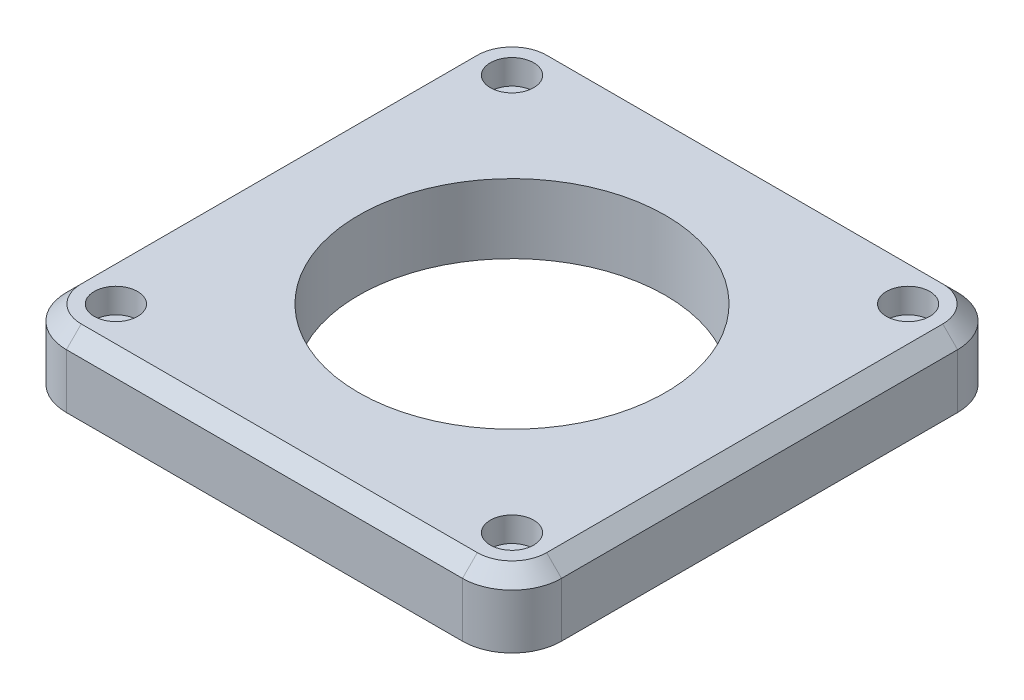
from build123d import *

# Parameters (mm, degrees)
SKETCH1_R           = 31
SKETCH1_R_2         = 2.625
BOSS_EXTRUDE1_DEPTH = 14
SKETCH2_R           = 4.375
CUT_EXTRUDE1_DEPTH  = 5
CHAMFER1_SIZE       = 3


with BuildPart() as part:
    # Sketch1 → Boss-Extrude1 (new body)
    with BuildSketch(Plane(origin=(0, 0, 0), x_dir=(1, 0, 0), z_dir=(0, 1, 0))):
        with BuildLine():
            Line((-40, -50), (40, -50))
            ThreePointArc((40, -50), (47.071067812, -47.071067812), (50, -40))
            Line((50, -40), (50, 40))
            ThreePointArc((50, 40), (47.071067812, 47.071067812), (40, 50))
            Line((40, 50), (-40, 50))
            ThreePointArc((-40, 50), (-47.071067812, 47.071067812), (-50, 40))
            Line((-50, 40), (-50, -40))
            ThreePointArc((-50, -40), (-47.071067812, -47.071067812), (-40, -50))
        make_face()
        Circle(SKETCH1_R, mode=Mode.SUBTRACT)
        with Locations((-40, -40)):
            Circle(SKETCH1_R_2, mode=Mode.SUBTRACT)
        with Locations((40, -40)):
            Circle(SKETCH1_R_2, mode=Mode.SUBTRACT)
        with Locations((40, 40)):
            Circle(SKETCH1_R_2, mode=Mode.SUBTRACT)
        with Locations((-40, 40)):
            Circle(SKETCH1_R_2, mode=Mode.SUBTRACT)
    extrude(amount=BOSS_EXTRUDE1_DEPTH)

    # Sketch2 → Cut-Extrude1 (cut)
    with BuildSketch(Plane(origin=(0, 14, 0), x_dir=(1, 0, 0), z_dir=(0, 1, 0))):
        with Locations((-40, 40)):
            Circle(SKETCH2_R)
        with Locations((40, 40)):
            Circle(SKETCH2_R)
        with Locations((40, -40)):
            Circle(SKETCH2_R)
        with Locations((-40, -40)):
            Circle(SKETCH2_R)
    extrude(amount=-CUT_EXTRUDE1_DEPTH, mode=Mode.SUBTRACT)

    # Chamfer1
    chamfer1_edges = [part.edges().sort_by_distance(p)[0] for p in [
        (0, 14, 50),
    ]]
    chamfer(chamfer1_edges, length=CHAMFER1_SIZE)


solid = part.part
